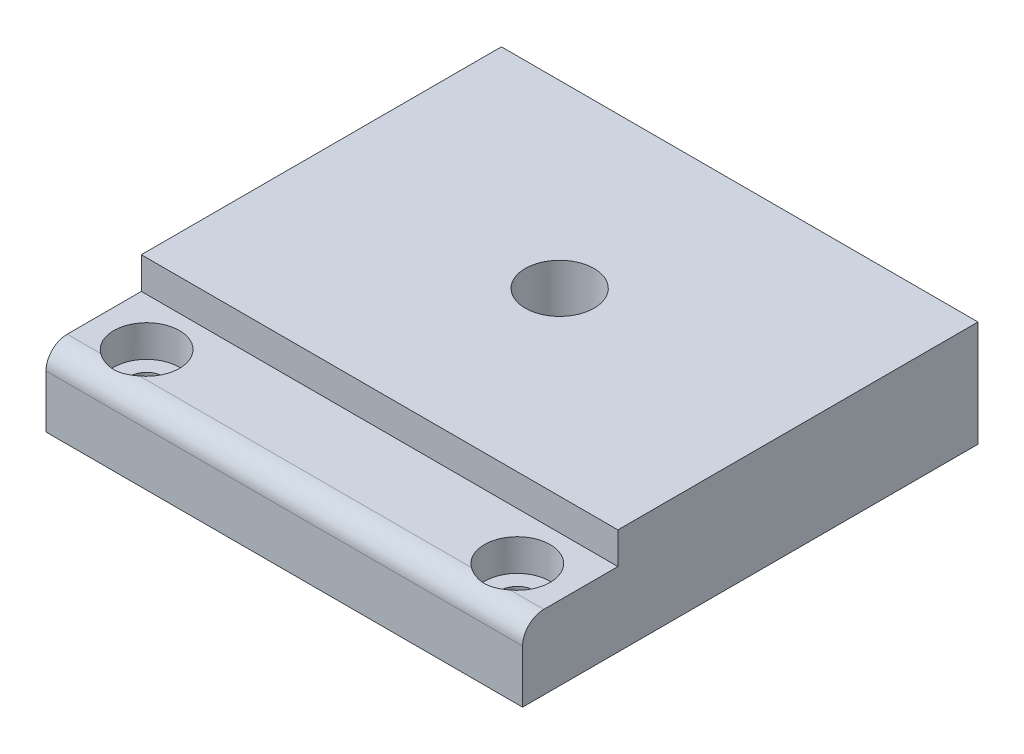
from build123d import *

# Parameters (mm, degrees)
ESBO_O1_W                  = 90
ESBO_O1_H                  = 3
RESSALTO_EXTRUS_O1_DEPTH   = 4
ESBO_O2_W                  = 45
ESBO_O2_H                  = 13
ESBO_O2_R                  = 1.6
RESSALTO_EXTRUS_O3_DEPTH   = 7
CORTE_EXTRUS_O1_DEPTH      = 10
CORTE_EXTRUS_O1_DEPTH_BACK = 3
ESBO_O3_R                  = 3.1
FILETE3_R                  = 2
ESBO_O4_W                  = 45
ESBO_O4_H                  = 3
CORTE_EXTRUS_O2_DEPTH      = 47.671726032
ESBO_O5_W                  = 30
ESBO_O5_H                  = 10
RESSALTO_EXTRUS_O4_DEPTH   = 45
ESBO_O6_R                  = 3.25
CORTE_EXTRUS_O3_DEPTH      = 56.000000082
ESBO_O7_R                  = 8.5
CORTE_EXTRUS_O5_DEPTH      = 3


with BuildPart() as part:
    # Esboço1 → Ressalto-extrusão1 (new body)
    with BuildSketch(Plane.XY):
        Rectangle(ESBO_O1_W, ESBO_O1_H)
    extrude(amount=RESSALTO_EXTRUS_O1_DEPTH)

    # Esboço2 → Ressalto-extrusão3 (add)
    with BuildSketch(Plane.XZ.offset(1.5)):
        with Locations((22.5, 6.5)):
            Rectangle(ESBO_O2_W, ESBO_O2_H)
        with Locations((40, 8.5)):
            Circle(ESBO_O2_R, mode=Mode.SUBTRACT)
        with Locations((5, 8.5)):
            Circle(ESBO_O2_R, mode=Mode.SUBTRACT)
    extrude(amount=RESSALTO_EXTRUS_O3_DEPTH)

    # Esboço3 → Corte-extrusão1 (cut, two sides: drawn at the far end of the back side and taken through both)
    with BuildSketch(Plane(origin=(0, -1.5, 0), x_dir=(1, 0, 0), z_dir=(0, 1, 0)).offset(-CORTE_EXTRUS_O1_DEPTH_BACK)):
        with Locations(Location((5, -8.5, 0), (0, 0, 180))):
            Circle(ESBO_O3_R)
        with Locations(Location((40, -8.5, 0), (0, 0, 180))):
            Circle(ESBO_O3_R)
    extrude(amount=CORTE_EXTRUS_O1_DEPTH + CORTE_EXTRUS_O1_DEPTH_BACK, mode=Mode.SUBTRACT)

    # Filete3
    # the kernel refuses this fillet: 2 mm, written as the material it takes off along each edge
    with BuildSketch(Plane(origin=(50, -1.5, 13), x_dir=(0, 0, -1), z_dir=(-1, 0, 0))) as filete3_piece_1:
        with BuildLine():
            CenterArc((FILETE3_R, FILETE3_R), FILETE3_R, 180, 90)
            Line((0, FILETE3_R), (0, 0))
            Line((0, 0), (FILETE3_R, 0))
        make_face()
    extrude(amount=55, mode=Mode.SUBTRACT)

    # Esboço4 → Corte-extrusão2 (cut, through all)
    with BuildSketch(Plane.XY.offset(4)):
        with Locations((-22.5, 0)):
            Rectangle(ESBO_O4_W, ESBO_O4_H)
    extrude(amount=-CORTE_EXTRUS_O2_DEPTH, mode=Mode.SUBTRACT)

    # Esboço5 → Ressalto-extrusão4 (add)
    with BuildSketch(Plane(origin=(45, 0, 0), x_dir=(0, 0, -1), z_dir=(1, 0, 0))):
        with Locations((15, -3.5)):
            Rectangle(ESBO_O5_W, ESBO_O5_H)
    extrude(amount=-RESSALTO_EXTRUS_O4_DEPTH)

    # Esboço6 → Corte-extrusão3 (cut, through all)
    with BuildSketch(Plane.XZ.offset(8.5)):
        with Locations((22.5, -13)):
            Circle(ESBO_O6_R)
    extrude(amount=-CORTE_EXTRUS_O3_DEPTH, mode=Mode.SUBTRACT)

    # Esboço7 → Corte-extrusão5 (cut)
    with BuildSketch(Plane(origin=(0, -8.5, 0), x_dir=(1, 0, 0), z_dir=(0, 1, 0))):
        with Locations(Location((22.5, 13, 0), (0, 0, 180))):
            Circle(ESBO_O7_R)
    extrude(amount=CORTE_EXTRUS_O5_DEPTH, mode=Mode.SUBTRACT)


solid = part.part
